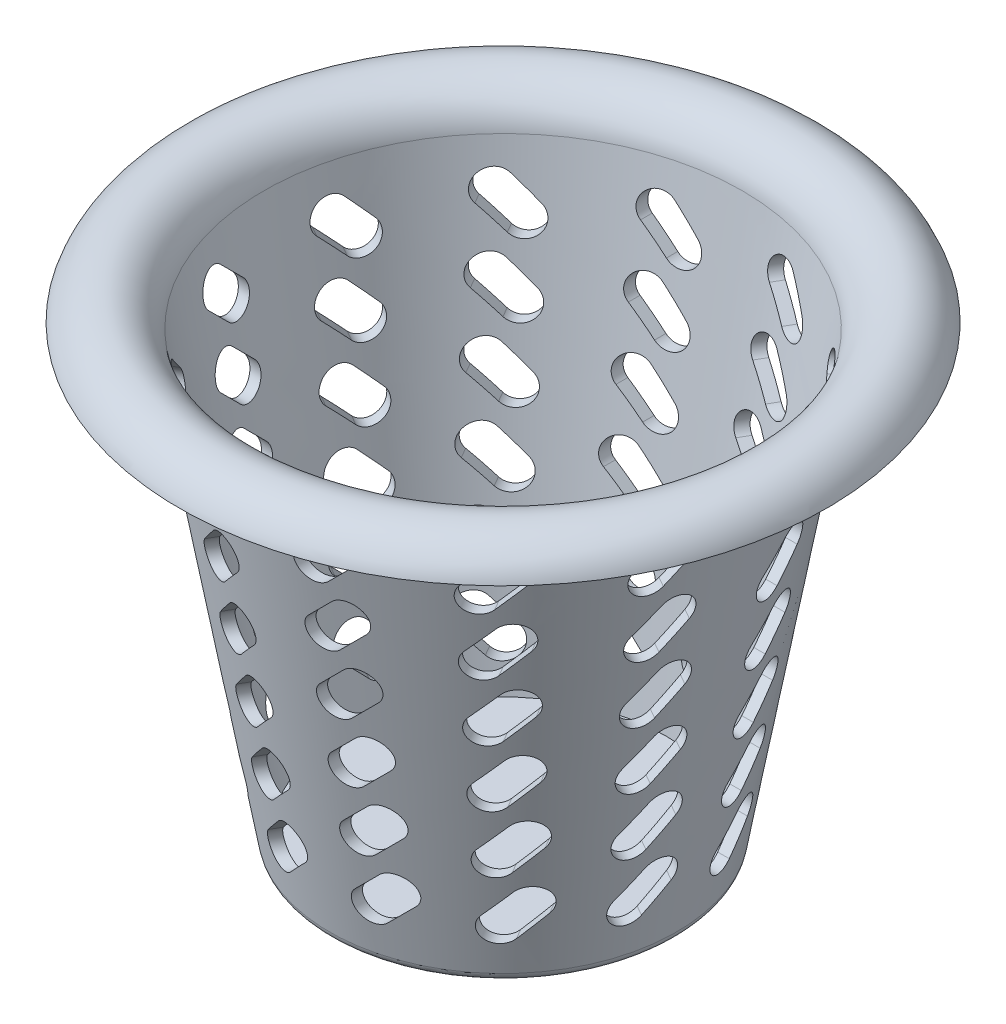
from build123d import *

# Parameters (mm, degrees)
FILLET1_R                 = 10
CUT_EXTRUDE1_DEPTH        = 605.228186298
LPATTERN1_COUNT           = 6
LPATTERN1_PITCH           = 60
CIRPATTERN1_COUNT         = 12
CIRPATTERN1_COPY_1_DEPTH  = 605.228186298
CIRPATTERN1_COPY_2_DEPTH  = 605.228186298
CIRPATTERN1_COPY_3_DEPTH  = 605.228186298
CIRPATTERN1_COPY_4_DEPTH  = 605.228186298
CIRPATTERN1_COPY_5_DEPTH  = 605.228186298
CIRPATTERN1_COPY_6_DEPTH  = 605.228186298
CIRPATTERN1_COPY_7_DEPTH  = 605.228186298
CIRPATTERN1_COPY_8_DEPTH  = 605.228186298
CIRPATTERN1_COPY_9_DEPTH  = 605.228186298
CIRPATTERN1_COPY_10_DEPTH = 605.228186298
CIRPATTERN1_COPY_11_DEPTH = 605.228186298
CIRPATTERN1_COPY_12_DEPTH = 605.228186298
CIRPATTERN1_COPY_13_DEPTH = 605.228186298
CIRPATTERN1_COPY_14_DEPTH = 605.228186298
CIRPATTERN1_COPY_15_DEPTH = 605.228186298
CIRPATTERN1_COPY_16_DEPTH = 605.228186298
CIRPATTERN1_COPY_17_DEPTH = 605.228186298
CIRPATTERN1_COPY_18_DEPTH = 605.228186298
CIRPATTERN1_COPY_19_DEPTH = 605.228186298
CIRPATTERN1_COPY_20_DEPTH = 605.228186298
CIRPATTERN1_COPY_21_DEPTH = 605.228186298
CIRPATTERN1_COPY_22_DEPTH = 605.228186298
CIRPATTERN1_COPY_23_DEPTH = 605.228186298
CIRPATTERN1_COPY_24_DEPTH = 605.228186298
CIRPATTERN1_COPY_25_DEPTH = 605.228186298
CIRPATTERN1_COPY_26_DEPTH = 605.228186298
CIRPATTERN1_COPY_27_DEPTH = 605.228186298
CIRPATTERN1_COPY_28_DEPTH = 605.228186298
CIRPATTERN1_COPY_29_DEPTH = 605.228186298
CIRPATTERN1_COPY_30_DEPTH = 605.228186298
CIRPATTERN1_COPY_31_DEPTH = 605.228186298
CIRPATTERN1_COPY_32_DEPTH = 605.228186298
CIRPATTERN1_COPY_33_DEPTH = 605.228186298
CIRPATTERN1_COPY_34_DEPTH = 605.228186298
CIRPATTERN1_COPY_35_DEPTH = 605.228186298
CIRPATTERN1_COPY_36_DEPTH = 605.228186298
CIRPATTERN1_COPY_37_DEPTH = 605.228186298
CIRPATTERN1_COPY_38_DEPTH = 605.228186298
CIRPATTERN1_COPY_39_DEPTH = 605.228186298
CIRPATTERN1_COPY_40_DEPTH = 605.228186298
CIRPATTERN1_COPY_41_DEPTH = 605.228186298
CIRPATTERN1_COPY_42_DEPTH = 605.228186298
CIRPATTERN1_COPY_43_DEPTH = 605.228186298
CIRPATTERN1_COPY_44_DEPTH = 605.228186298
CIRPATTERN1_COPY_45_DEPTH = 605.228186298
CIRPATTERN1_COPY_46_DEPTH = 605.228186298
CIRPATTERN1_COPY_47_DEPTH = 605.228186298
CIRPATTERN1_COPY_48_DEPTH = 605.228186298
CIRPATTERN1_COPY_49_DEPTH = 605.228186298
CIRPATTERN1_COPY_50_DEPTH = 605.228186298
CIRPATTERN1_COPY_51_DEPTH = 605.228186298
CIRPATTERN1_COPY_52_DEPTH = 605.228186298
CIRPATTERN1_COPY_53_DEPTH = 605.228186298
CIRPATTERN1_COPY_54_DEPTH = 605.228186298
CIRPATTERN1_COPY_55_DEPTH = 605.228186298


with BuildPart() as part:
    # Sketch1 → Revolve-Thin1 (revolve)
    with BuildSketch(Plane.XY, mode=Mode.PRIVATE) as revolve_thin1_sk:
        with BuildLine():
            Line((0, 0), (150, 0))
            Line((150, 0), (220.530792283, 400))
            ThreePointArc((220.530792283, 400), (257.118174154, 432.955606417), (297.956264392, 405.442720487))
            Line((297.956264392, 405.442720487), (288.447973895, 402.345558589))
            ThreePointArc((288.447973895, 402.345558589), (257.819406216, 422.980223036), (230.378869814, 398.263518223))
            Line((230.378869814, 398.263518223), (158.390996312, -10))
            Line((158.390996312, -10), (0, -10))
            Line((0, -10), (0, 0))
        make_face()
    revolve(revolve_thin1_sk.sketch.rotate(Axis((0, 0, 0), (0, 1, 0)), 90), axis=Axis((0, 0, 0), (0, 1, 0)))

    # Fillet1
    fillet1_edges = [part.edges().sort_by_distance(p)[0] for p in [
        (0, -10, 158.390996312),
    ]]
    fillet(fillet1_edges, radius=FILLET1_R)

    # Sketch2 → Cut-Extrude1 (cut, through all)
    with BuildSketch(Plane.XY):
        with BuildLine():
            Line((-51.213203436, 72.426406871), (-30, 51.213203436))
            ThreePointArc((-30, 51.213203436), (-30, 30), (-51.213203436, 30))
            Line((-51.213203436, 30), (-72.426406871, 51.213203436))
            ThreePointArc((-72.426406871, 51.213203436), (-72.426406871, 72.426406871), (-51.213203436, 72.426406871))
        make_face()
    cut_extrude1 = extrude(amount=-CUT_EXTRUDE1_DEPTH, mode=Mode.SUBTRACT)

    # LPattern1: Cut-Extrude1 ×6
    with Locations(*[(0, i * LPATTERN1_PITCH, 0) for i in range(1, LPATTERN1_COUNT)]):
        add(cut_extrude1, mode=Mode.SUBTRACT)

    # CirPattern1: Cut-Extrude1 ×12 about axis
    cirpattern1_axis = Axis((0, 0, 0), (0, 1, 0))
    for i in range(1, CIRPATTERN1_COUNT):
        add(cut_extrude1.rotate(cirpattern1_axis, i * 360 / CIRPATTERN1_COUNT), mode=Mode.SUBTRACT)

    # CirPattern1 copy 1 sketch → CirPattern1 copy 1 (cut, through all)
    with BuildSketch(Plane(origin=(0, 60, 0), x_dir=(0.8660254037844387, 0, -0.49999999999999994), z_dir=(0.49999999999999994, 0, 0.8660254037844387))):
        with BuildLine():
            Line((-51.213203436, 72.426406871), (-30, 51.213203436))
            ThreePointArc((-30, 51.213203436), (-30, 30), (-51.213203436, 30))
            Line((-51.213203436, 30), (-72.426406871, 51.213203436))
            ThreePointArc((-72.426406871, 51.213203436), (-72.426406871, 72.426406871), (-51.213203436, 72.426406871))
        make_face()
    extrude(amount=-CIRPATTERN1_COPY_1_DEPTH, mode=Mode.SUBTRACT)

    # CirPattern1 copy 2 sketch → CirPattern1 copy 2 (cut, through all)
    with BuildSketch(Plane(origin=(0, 60, 0), x_dir=(0.5000000000000001, 0, -0.8660254037844386), z_dir=(0.8660254037844386, 0, 0.5000000000000001))):
        with BuildLine():
            Line((-51.213203436, 72.426406871), (-30, 51.213203436))
            ThreePointArc((-30, 51.213203436), (-30, 30), (-51.213203436, 30))
            Line((-51.213203436, 30), (-72.426406871, 51.213203436))
            ThreePointArc((-72.426406871, 51.213203436), (-72.426406871, 72.426406871), (-51.213203436, 72.426406871))
        make_face()
    extrude(amount=-CIRPATTERN1_COPY_2_DEPTH, mode=Mode.SUBTRACT)

    # CirPattern1 copy 3 sketch → CirPattern1 copy 3 (cut, through all)
    with BuildSketch(Plane(origin=(0, 60, 0), x_dir=(0, 0, -1), z_dir=(1, 0, 0))):
        with BuildLine():
            Line((-51.213203436, 72.426406871), (-30, 51.213203436))
            ThreePointArc((-30, 51.213203436), (-30, 30), (-51.213203436, 30))
            Line((-51.213203436, 30), (-72.426406871, 51.213203436))
            ThreePointArc((-72.426406871, 51.213203436), (-72.426406871, 72.426406871), (-51.213203436, 72.426406871))
        make_face()
    extrude(amount=-CIRPATTERN1_COPY_3_DEPTH, mode=Mode.SUBTRACT)

    # CirPattern1 copy 4 sketch → CirPattern1 copy 4 (cut, through all)
    with BuildSketch(Plane(origin=(0, 60, 0), x_dir=(-0.4999999999999998, 0, -0.8660254037844387), z_dir=(0.8660254037844387, 0, -0.4999999999999998))):
        with BuildLine():
            Line((-51.213203436, 72.426406871), (-30, 51.213203436))
            ThreePointArc((-30, 51.213203436), (-30, 30), (-51.213203436, 30))
            Line((-51.213203436, 30), (-72.426406871, 51.213203436))
            ThreePointArc((-72.426406871, 51.213203436), (-72.426406871, 72.426406871), (-51.213203436, 72.426406871))
        make_face()
    extrude(amount=-CIRPATTERN1_COPY_4_DEPTH, mode=Mode.SUBTRACT)

    # CirPattern1 copy 5 sketch → CirPattern1 copy 5 (cut, through all)
    with BuildSketch(Plane(origin=(0, 60, 0), x_dir=(-0.8660254037844387, 0, -0.49999999999999994), z_dir=(0.49999999999999994, 0, -0.8660254037844387))):
        with BuildLine():
            Line((-51.213203436, 72.426406871), (-30, 51.213203436))
            ThreePointArc((-30, 51.213203436), (-30, 30), (-51.213203436, 30))
            Line((-51.213203436, 30), (-72.426406871, 51.213203436))
            ThreePointArc((-72.426406871, 51.213203436), (-72.426406871, 72.426406871), (-51.213203436, 72.426406871))
        make_face()
    extrude(amount=-CIRPATTERN1_COPY_5_DEPTH, mode=Mode.SUBTRACT)

    # CirPattern1 copy 6 sketch → CirPattern1 copy 6 (cut, through all)
    with BuildSketch(Plane(origin=(0, 60, 0), x_dir=(-1, 0, 0), z_dir=(0, 0, -1))):
        with BuildLine():
            Line((-51.213203436, 72.426406871), (-30, 51.213203436))
            ThreePointArc((-30, 51.213203436), (-30, 30), (-51.213203436, 30))
            Line((-51.213203436, 30), (-72.426406871, 51.213203436))
            ThreePointArc((-72.426406871, 51.213203436), (-72.426406871, 72.426406871), (-51.213203436, 72.426406871))
        make_face()
    extrude(amount=-CIRPATTERN1_COPY_6_DEPTH, mode=Mode.SUBTRACT)

    # CirPattern1 copy 7 sketch → CirPattern1 copy 7 (cut, through all)
    with BuildSketch(Plane(origin=(0, 60, 0), x_dir=(-0.8660254037844386, 0, 0.5000000000000001), z_dir=(-0.5000000000000001, 0, -0.8660254037844386))):
        with BuildLine():
            Line((-51.213203436, 72.426406871), (-30, 51.213203436))
            ThreePointArc((-30, 51.213203436), (-30, 30), (-51.213203436, 30))
            Line((-51.213203436, 30), (-72.426406871, 51.213203436))
            ThreePointArc((-72.426406871, 51.213203436), (-72.426406871, 72.426406871), (-51.213203436, 72.426406871))
        make_face()
    extrude(amount=-CIRPATTERN1_COPY_7_DEPTH, mode=Mode.SUBTRACT)

    # CirPattern1 copy 8 sketch → CirPattern1 copy 8 (cut, through all)
    with BuildSketch(Plane(origin=(0, 60, 0), x_dir=(-0.5000000000000004, 0, 0.8660254037844384), z_dir=(-0.8660254037844384, 0, -0.5000000000000004))):
        with BuildLine():
            Line((-51.213203436, 72.426406871), (-30, 51.213203436))
            ThreePointArc((-30, 51.213203436), (-30, 30), (-51.213203436, 30))
            Line((-51.213203436, 30), (-72.426406871, 51.213203436))
            ThreePointArc((-72.426406871, 51.213203436), (-72.426406871, 72.426406871), (-51.213203436, 72.426406871))
        make_face()
    extrude(amount=-CIRPATTERN1_COPY_8_DEPTH, mode=Mode.SUBTRACT)

    # CirPattern1 copy 9 sketch → CirPattern1 copy 9 (cut, through all)
    with BuildSketch(Plane(origin=(0, 60, 0), x_dir=(0, 0, 1), z_dir=(-1, 0, 0))):
        with BuildLine():
            Line((-51.213203436, 72.426406871), (-30, 51.213203436))
            ThreePointArc((-30, 51.213203436), (-30, 30), (-51.213203436, 30))
            Line((-51.213203436, 30), (-72.426406871, 51.213203436))
            ThreePointArc((-72.426406871, 51.213203436), (-72.426406871, 72.426406871), (-51.213203436, 72.426406871))
        make_face()
    extrude(amount=-CIRPATTERN1_COPY_9_DEPTH, mode=Mode.SUBTRACT)

    # CirPattern1 copy 10 sketch → CirPattern1 copy 10 (cut, through all)
    with BuildSketch(Plane(origin=(0, 60, 0), x_dir=(0.5000000000000001, 0, 0.8660254037844386), z_dir=(-0.8660254037844386, 0, 0.5000000000000001))):
        with BuildLine():
            Line((-51.213203436, 72.426406871), (-30, 51.213203436))
            ThreePointArc((-30, 51.213203436), (-30, 30), (-51.213203436, 30))
            Line((-51.213203436, 30), (-72.426406871, 51.213203436))
            ThreePointArc((-72.426406871, 51.213203436), (-72.426406871, 72.426406871), (-51.213203436, 72.426406871))
        make_face()
    extrude(amount=-CIRPATTERN1_COPY_10_DEPTH, mode=Mode.SUBTRACT)

    # CirPattern1 copy 11 sketch → CirPattern1 copy 11 (cut, through all)
    with BuildSketch(Plane(origin=(0, 60, 0), x_dir=(0.8660254037844384, 0, 0.5000000000000004), z_dir=(-0.5000000000000004, 0, 0.8660254037844384))):
        with BuildLine():
            Line((-51.213203436, 72.426406871), (-30, 51.213203436))
            ThreePointArc((-30, 51.213203436), (-30, 30), (-51.213203436, 30))
            Line((-51.213203436, 30), (-72.426406871, 51.213203436))
            ThreePointArc((-72.426406871, 51.213203436), (-72.426406871, 72.426406871), (-51.213203436, 72.426406871))
        make_face()
    extrude(amount=-CIRPATTERN1_COPY_11_DEPTH, mode=Mode.SUBTRACT)

    # CirPattern1 copy 12 sketch → CirPattern1 copy 12 (cut, through all)
    with BuildSketch(Plane(origin=(0, 120, 0), x_dir=(0.8660254037844387, 0, -0.49999999999999994), z_dir=(0.49999999999999994, 0, 0.8660254037844387))):
        with BuildLine():
            Line((-51.213203436, 72.426406871), (-30, 51.213203436))
            ThreePointArc((-30, 51.213203436), (-30, 30), (-51.213203436, 30))
            Line((-51.213203436, 30), (-72.426406871, 51.213203436))
            ThreePointArc((-72.426406871, 51.213203436), (-72.426406871, 72.426406871), (-51.213203436, 72.426406871))
        make_face()
    extrude(amount=-CIRPATTERN1_COPY_12_DEPTH, mode=Mode.SUBTRACT)

    # CirPattern1 copy 13 sketch → CirPattern1 copy 13 (cut, through all)
    with BuildSketch(Plane(origin=(0, 120, 0), x_dir=(0.5000000000000001, 0, -0.8660254037844386), z_dir=(0.8660254037844386, 0, 0.5000000000000001))):
        with BuildLine():
            Line((-51.213203436, 72.426406871), (-30, 51.213203436))
            ThreePointArc((-30, 51.213203436), (-30, 30), (-51.213203436, 30))
            Line((-51.213203436, 30), (-72.426406871, 51.213203436))
            ThreePointArc((-72.426406871, 51.213203436), (-72.426406871, 72.426406871), (-51.213203436, 72.426406871))
        make_face()
    extrude(amount=-CIRPATTERN1_COPY_13_DEPTH, mode=Mode.SUBTRACT)

    # CirPattern1 copy 14 sketch → CirPattern1 copy 14 (cut, through all)
    with BuildSketch(Plane(origin=(0, 120, 0), x_dir=(0, 0, -1), z_dir=(1, 0, 0))):
        with BuildLine():
            Line((-51.213203436, 72.426406871), (-30, 51.213203436))
            ThreePointArc((-30, 51.213203436), (-30, 30), (-51.213203436, 30))
            Line((-51.213203436, 30), (-72.426406871, 51.213203436))
            ThreePointArc((-72.426406871, 51.213203436), (-72.426406871, 72.426406871), (-51.213203436, 72.426406871))
        make_face()
    extrude(amount=-CIRPATTERN1_COPY_14_DEPTH, mode=Mode.SUBTRACT)

    # CirPattern1 copy 15 sketch → CirPattern1 copy 15 (cut, through all)
    with BuildSketch(Plane(origin=(0, 120, 0), x_dir=(-0.4999999999999998, 0, -0.8660254037844387), z_dir=(0.8660254037844387, 0, -0.4999999999999998))):
        with BuildLine():
            Line((-51.213203436, 72.426406871), (-30, 51.213203436))
            ThreePointArc((-30, 51.213203436), (-30, 30), (-51.213203436, 30))
            Line((-51.213203436, 30), (-72.426406871, 51.213203436))
            ThreePointArc((-72.426406871, 51.213203436), (-72.426406871, 72.426406871), (-51.213203436, 72.426406871))
        make_face()
    extrude(amount=-CIRPATTERN1_COPY_15_DEPTH, mode=Mode.SUBTRACT)

    # CirPattern1 copy 16 sketch → CirPattern1 copy 16 (cut, through all)
    with BuildSketch(Plane(origin=(0, 120, 0), x_dir=(-0.8660254037844387, 0, -0.49999999999999994), z_dir=(0.49999999999999994, 0, -0.8660254037844387))):
        with BuildLine():
            Line((-51.213203436, 72.426406871), (-30, 51.213203436))
            ThreePointArc((-30, 51.213203436), (-30, 30), (-51.213203436, 30))
            Line((-51.213203436, 30), (-72.426406871, 51.213203436))
            ThreePointArc((-72.426406871, 51.213203436), (-72.426406871, 72.426406871), (-51.213203436, 72.426406871))
        make_face()
    extrude(amount=-CIRPATTERN1_COPY_16_DEPTH, mode=Mode.SUBTRACT)

    # CirPattern1 copy 17 sketch → CirPattern1 copy 17 (cut, through all)
    with BuildSketch(Plane(origin=(0, 120, 0), x_dir=(-1, 0, 0), z_dir=(0, 0, -1))):
        with BuildLine():
            Line((-51.213203436, 72.426406871), (-30, 51.213203436))
            ThreePointArc((-30, 51.213203436), (-30, 30), (-51.213203436, 30))
            Line((-51.213203436, 30), (-72.426406871, 51.213203436))
            ThreePointArc((-72.426406871, 51.213203436), (-72.426406871, 72.426406871), (-51.213203436, 72.426406871))
        make_face()
    extrude(amount=-CIRPATTERN1_COPY_17_DEPTH, mode=Mode.SUBTRACT)

    # CirPattern1 copy 18 sketch → CirPattern1 copy 18 (cut, through all)
    with BuildSketch(Plane(origin=(0, 120, 0), x_dir=(-0.8660254037844386, 0, 0.5000000000000001), z_dir=(-0.5000000000000001, 0, -0.8660254037844386))):
        with BuildLine():
            Line((-51.213203436, 72.426406871), (-30, 51.213203436))
            ThreePointArc((-30, 51.213203436), (-30, 30), (-51.213203436, 30))
            Line((-51.213203436, 30), (-72.426406871, 51.213203436))
            ThreePointArc((-72.426406871, 51.213203436), (-72.426406871, 72.426406871), (-51.213203436, 72.426406871))
        make_face()
    extrude(amount=-CIRPATTERN1_COPY_18_DEPTH, mode=Mode.SUBTRACT)

    # CirPattern1 copy 19 sketch → CirPattern1 copy 19 (cut, through all)
    with BuildSketch(Plane(origin=(0, 120, 0), x_dir=(-0.5000000000000004, 0, 0.8660254037844384), z_dir=(-0.8660254037844384, 0, -0.5000000000000004))):
        with BuildLine():
            Line((-51.213203436, 72.426406871), (-30, 51.213203436))
            ThreePointArc((-30, 51.213203436), (-30, 30), (-51.213203436, 30))
            Line((-51.213203436, 30), (-72.426406871, 51.213203436))
            ThreePointArc((-72.426406871, 51.213203436), (-72.426406871, 72.426406871), (-51.213203436, 72.426406871))
        make_face()
    extrude(amount=-CIRPATTERN1_COPY_19_DEPTH, mode=Mode.SUBTRACT)

    # CirPattern1 copy 20 sketch → CirPattern1 copy 20 (cut, through all)
    with BuildSketch(Plane(origin=(0, 120, 0), x_dir=(0, 0, 1), z_dir=(-1, 0, 0))):
        with BuildLine():
            Line((-51.213203436, 72.426406871), (-30, 51.213203436))
            ThreePointArc((-30, 51.213203436), (-30, 30), (-51.213203436, 30))
            Line((-51.213203436, 30), (-72.426406871, 51.213203436))
            ThreePointArc((-72.426406871, 51.213203436), (-72.426406871, 72.426406871), (-51.213203436, 72.426406871))
        make_face()
    extrude(amount=-CIRPATTERN1_COPY_20_DEPTH, mode=Mode.SUBTRACT)

    # CirPattern1 copy 21 sketch → CirPattern1 copy 21 (cut, through all)
    with BuildSketch(Plane(origin=(0, 120, 0), x_dir=(0.5000000000000001, 0, 0.8660254037844386), z_dir=(-0.8660254037844386, 0, 0.5000000000000001))):
        with BuildLine():
            Line((-51.213203436, 72.426406871), (-30, 51.213203436))
            ThreePointArc((-30, 51.213203436), (-30, 30), (-51.213203436, 30))
            Line((-51.213203436, 30), (-72.426406871, 51.213203436))
            ThreePointArc((-72.426406871, 51.213203436), (-72.426406871, 72.426406871), (-51.213203436, 72.426406871))
        make_face()
    extrude(amount=-CIRPATTERN1_COPY_21_DEPTH, mode=Mode.SUBTRACT)

    # CirPattern1 copy 22 sketch → CirPattern1 copy 22 (cut, through all)
    with BuildSketch(Plane(origin=(0, 120, 0), x_dir=(0.8660254037844384, 0, 0.5000000000000004), z_dir=(-0.5000000000000004, 0, 0.8660254037844384))):
        with BuildLine():
            Line((-51.213203436, 72.426406871), (-30, 51.213203436))
            ThreePointArc((-30, 51.213203436), (-30, 30), (-51.213203436, 30))
            Line((-51.213203436, 30), (-72.426406871, 51.213203436))
            ThreePointArc((-72.426406871, 51.213203436), (-72.426406871, 72.426406871), (-51.213203436, 72.426406871))
        make_face()
    extrude(amount=-CIRPATTERN1_COPY_22_DEPTH, mode=Mode.SUBTRACT)

    # CirPattern1 copy 23 sketch → CirPattern1 copy 23 (cut, through all)
    with BuildSketch(Plane(origin=(0, 180, 0), x_dir=(0.8660254037844387, 0, -0.49999999999999994), z_dir=(0.49999999999999994, 0, 0.8660254037844387))):
        with BuildLine():
            Line((-51.213203436, 72.426406871), (-30, 51.213203436))
            ThreePointArc((-30, 51.213203436), (-30, 30), (-51.213203436, 30))
            Line((-51.213203436, 30), (-72.426406871, 51.213203436))
            ThreePointArc((-72.426406871, 51.213203436), (-72.426406871, 72.426406871), (-51.213203436, 72.426406871))
        make_face()
    extrude(amount=-CIRPATTERN1_COPY_23_DEPTH, mode=Mode.SUBTRACT)

    # CirPattern1 copy 24 sketch → CirPattern1 copy 24 (cut, through all)
    with BuildSketch(Plane(origin=(0, 180, 0), x_dir=(0.5000000000000001, 0, -0.8660254037844386), z_dir=(0.8660254037844386, 0, 0.5000000000000001))):
        with BuildLine():
            Line((-51.213203436, 72.426406871), (-30, 51.213203436))
            ThreePointArc((-30, 51.213203436), (-30, 30), (-51.213203436, 30))
            Line((-51.213203436, 30), (-72.426406871, 51.213203436))
            ThreePointArc((-72.426406871, 51.213203436), (-72.426406871, 72.426406871), (-51.213203436, 72.426406871))
        make_face()
    extrude(amount=-CIRPATTERN1_COPY_24_DEPTH, mode=Mode.SUBTRACT)

    # CirPattern1 copy 25 sketch → CirPattern1 copy 25 (cut, through all)
    with BuildSketch(Plane(origin=(0, 180, 0), x_dir=(0, 0, -1), z_dir=(1, 0, 0))):
        with BuildLine():
            Line((-51.213203436, 72.426406871), (-30, 51.213203436))
            ThreePointArc((-30, 51.213203436), (-30, 30), (-51.213203436, 30))
            Line((-51.213203436, 30), (-72.426406871, 51.213203436))
            ThreePointArc((-72.426406871, 51.213203436), (-72.426406871, 72.426406871), (-51.213203436, 72.426406871))
        make_face()
    extrude(amount=-CIRPATTERN1_COPY_25_DEPTH, mode=Mode.SUBTRACT)

    # CirPattern1 copy 26 sketch → CirPattern1 copy 26 (cut, through all)
    with BuildSketch(Plane(origin=(0, 180, 0), x_dir=(-0.4999999999999998, 0, -0.8660254037844387), z_dir=(0.8660254037844387, 0, -0.4999999999999998))):
        with BuildLine():
            Line((-51.213203436, 72.426406871), (-30, 51.213203436))
            ThreePointArc((-30, 51.213203436), (-30, 30), (-51.213203436, 30))
            Line((-51.213203436, 30), (-72.426406871, 51.213203436))
            ThreePointArc((-72.426406871, 51.213203436), (-72.426406871, 72.426406871), (-51.213203436, 72.426406871))
        make_face()
    extrude(amount=-CIRPATTERN1_COPY_26_DEPTH, mode=Mode.SUBTRACT)

    # CirPattern1 copy 27 sketch → CirPattern1 copy 27 (cut, through all)
    with BuildSketch(Plane(origin=(0, 180, 0), x_dir=(-0.8660254037844387, 0, -0.49999999999999994), z_dir=(0.49999999999999994, 0, -0.8660254037844387))):
        with BuildLine():
            Line((-51.213203436, 72.426406871), (-30, 51.213203436))
            ThreePointArc((-30, 51.213203436), (-30, 30), (-51.213203436, 30))
            Line((-51.213203436, 30), (-72.426406871, 51.213203436))
            ThreePointArc((-72.426406871, 51.213203436), (-72.426406871, 72.426406871), (-51.213203436, 72.426406871))
        make_face()
    extrude(amount=-CIRPATTERN1_COPY_27_DEPTH, mode=Mode.SUBTRACT)

    # CirPattern1 copy 28 sketch → CirPattern1 copy 28 (cut, through all)
    with BuildSketch(Plane(origin=(0, 180, 0), x_dir=(-1, 0, 0), z_dir=(0, 0, -1))):
        with BuildLine():
            Line((-51.213203436, 72.426406871), (-30, 51.213203436))
            ThreePointArc((-30, 51.213203436), (-30, 30), (-51.213203436, 30))
            Line((-51.213203436, 30), (-72.426406871, 51.213203436))
            ThreePointArc((-72.426406871, 51.213203436), (-72.426406871, 72.426406871), (-51.213203436, 72.426406871))
        make_face()
    extrude(amount=-CIRPATTERN1_COPY_28_DEPTH, mode=Mode.SUBTRACT)

    # CirPattern1 copy 29 sketch → CirPattern1 copy 29 (cut, through all)
    with BuildSketch(Plane(origin=(0, 180, 0), x_dir=(-0.8660254037844386, 0, 0.5000000000000001), z_dir=(-0.5000000000000001, 0, -0.8660254037844386))):
        with BuildLine():
            Line((-51.213203436, 72.426406871), (-30, 51.213203436))
            ThreePointArc((-30, 51.213203436), (-30, 30), (-51.213203436, 30))
            Line((-51.213203436, 30), (-72.426406871, 51.213203436))
            ThreePointArc((-72.426406871, 51.213203436), (-72.426406871, 72.426406871), (-51.213203436, 72.426406871))
        make_face()
    extrude(amount=-CIRPATTERN1_COPY_29_DEPTH, mode=Mode.SUBTRACT)

    # CirPattern1 copy 30 sketch → CirPattern1 copy 30 (cut, through all)
    with BuildSketch(Plane(origin=(0, 180, 0), x_dir=(-0.5000000000000004, 0, 0.8660254037844384), z_dir=(-0.8660254037844384, 0, -0.5000000000000004))):
        with BuildLine():
            Line((-51.213203436, 72.426406871), (-30, 51.213203436))
            ThreePointArc((-30, 51.213203436), (-30, 30), (-51.213203436, 30))
            Line((-51.213203436, 30), (-72.426406871, 51.213203436))
            ThreePointArc((-72.426406871, 51.213203436), (-72.426406871, 72.426406871), (-51.213203436, 72.426406871))
        make_face()
    extrude(amount=-CIRPATTERN1_COPY_30_DEPTH, mode=Mode.SUBTRACT)

    # CirPattern1 copy 31 sketch → CirPattern1 copy 31 (cut, through all)
    with BuildSketch(Plane(origin=(0, 180, 0), x_dir=(0, 0, 1), z_dir=(-1, 0, 0))):
        with BuildLine():
            Line((-51.213203436, 72.426406871), (-30, 51.213203436))
            ThreePointArc((-30, 51.213203436), (-30, 30), (-51.213203436, 30))
            Line((-51.213203436, 30), (-72.426406871, 51.213203436))
            ThreePointArc((-72.426406871, 51.213203436), (-72.426406871, 72.426406871), (-51.213203436, 72.426406871))
        make_face()
    extrude(amount=-CIRPATTERN1_COPY_31_DEPTH, mode=Mode.SUBTRACT)

    # CirPattern1 copy 32 sketch → CirPattern1 copy 32 (cut, through all)
    with BuildSketch(Plane(origin=(0, 180, 0), x_dir=(0.5000000000000001, 0, 0.8660254037844386), z_dir=(-0.8660254037844386, 0, 0.5000000000000001))):
        with BuildLine():
            Line((-51.213203436, 72.426406871), (-30, 51.213203436))
            ThreePointArc((-30, 51.213203436), (-30, 30), (-51.213203436, 30))
            Line((-51.213203436, 30), (-72.426406871, 51.213203436))
            ThreePointArc((-72.426406871, 51.213203436), (-72.426406871, 72.426406871), (-51.213203436, 72.426406871))
        make_face()
    extrude(amount=-CIRPATTERN1_COPY_32_DEPTH, mode=Mode.SUBTRACT)

    # CirPattern1 copy 33 sketch → CirPattern1 copy 33 (cut, through all)
    with BuildSketch(Plane(origin=(0, 180, 0), x_dir=(0.8660254037844384, 0, 0.5000000000000004), z_dir=(-0.5000000000000004, 0, 0.8660254037844384))):
        with BuildLine():
            Line((-51.213203436, 72.426406871), (-30, 51.213203436))
            ThreePointArc((-30, 51.213203436), (-30, 30), (-51.213203436, 30))
            Line((-51.213203436, 30), (-72.426406871, 51.213203436))
            ThreePointArc((-72.426406871, 51.213203436), (-72.426406871, 72.426406871), (-51.213203436, 72.426406871))
        make_face()
    extrude(amount=-CIRPATTERN1_COPY_33_DEPTH, mode=Mode.SUBTRACT)

    # CirPattern1 copy 34 sketch → CirPattern1 copy 34 (cut, through all)
    with BuildSketch(Plane(origin=(0, 240, 0), x_dir=(0.8660254037844387, 0, -0.49999999999999994), z_dir=(0.49999999999999994, 0, 0.8660254037844387))):
        with BuildLine():
            Line((-51.213203436, 72.426406871), (-30, 51.213203436))
            ThreePointArc((-30, 51.213203436), (-30, 30), (-51.213203436, 30))
            Line((-51.213203436, 30), (-72.426406871, 51.213203436))
            ThreePointArc((-72.426406871, 51.213203436), (-72.426406871, 72.426406871), (-51.213203436, 72.426406871))
        make_face()
    extrude(amount=-CIRPATTERN1_COPY_34_DEPTH, mode=Mode.SUBTRACT)

    # CirPattern1 copy 35 sketch → CirPattern1 copy 35 (cut, through all)
    with BuildSketch(Plane(origin=(0, 240, 0), x_dir=(0.5000000000000001, 0, -0.8660254037844386), z_dir=(0.8660254037844386, 0, 0.5000000000000001))):
        with BuildLine():
            Line((-51.213203436, 72.426406871), (-30, 51.213203436))
            ThreePointArc((-30, 51.213203436), (-30, 30), (-51.213203436, 30))
            Line((-51.213203436, 30), (-72.426406871, 51.213203436))
            ThreePointArc((-72.426406871, 51.213203436), (-72.426406871, 72.426406871), (-51.213203436, 72.426406871))
        make_face()
    extrude(amount=-CIRPATTERN1_COPY_35_DEPTH, mode=Mode.SUBTRACT)

    # CirPattern1 copy 36 sketch → CirPattern1 copy 36 (cut, through all)
    with BuildSketch(Plane(origin=(0, 240, 0), x_dir=(0, 0, -1), z_dir=(1, 0, 0))):
        with BuildLine():
            Line((-51.213203436, 72.426406871), (-30, 51.213203436))
            ThreePointArc((-30, 51.213203436), (-30, 30), (-51.213203436, 30))
            Line((-51.213203436, 30), (-72.426406871, 51.213203436))
            ThreePointArc((-72.426406871, 51.213203436), (-72.426406871, 72.426406871), (-51.213203436, 72.426406871))
        make_face()
    extrude(amount=-CIRPATTERN1_COPY_36_DEPTH, mode=Mode.SUBTRACT)

    # CirPattern1 copy 37 sketch → CirPattern1 copy 37 (cut, through all)
    with BuildSketch(Plane(origin=(0, 240, 0), x_dir=(-0.4999999999999998, 0, -0.8660254037844387), z_dir=(0.8660254037844387, 0, -0.4999999999999998))):
        with BuildLine():
            Line((-51.213203436, 72.426406871), (-30, 51.213203436))
            ThreePointArc((-30, 51.213203436), (-30, 30), (-51.213203436, 30))
            Line((-51.213203436, 30), (-72.426406871, 51.213203436))
            ThreePointArc((-72.426406871, 51.213203436), (-72.426406871, 72.426406871), (-51.213203436, 72.426406871))
        make_face()
    extrude(amount=-CIRPATTERN1_COPY_37_DEPTH, mode=Mode.SUBTRACT)

    # CirPattern1 copy 38 sketch → CirPattern1 copy 38 (cut, through all)
    with BuildSketch(Plane(origin=(0, 240, 0), x_dir=(-0.8660254037844387, 0, -0.49999999999999994), z_dir=(0.49999999999999994, 0, -0.8660254037844387))):
        with BuildLine():
            Line((-51.213203436, 72.426406871), (-30, 51.213203436))
            ThreePointArc((-30, 51.213203436), (-30, 30), (-51.213203436, 30))
            Line((-51.213203436, 30), (-72.426406871, 51.213203436))
            ThreePointArc((-72.426406871, 51.213203436), (-72.426406871, 72.426406871), (-51.213203436, 72.426406871))
        make_face()
    extrude(amount=-CIRPATTERN1_COPY_38_DEPTH, mode=Mode.SUBTRACT)

    # CirPattern1 copy 39 sketch → CirPattern1 copy 39 (cut, through all)
    with BuildSketch(Plane(origin=(0, 240, 0), x_dir=(-1, 0, 0), z_dir=(0, 0, -1))):
        with BuildLine():
            Line((-51.213203436, 72.426406871), (-30, 51.213203436))
            ThreePointArc((-30, 51.213203436), (-30, 30), (-51.213203436, 30))
            Line((-51.213203436, 30), (-72.426406871, 51.213203436))
            ThreePointArc((-72.426406871, 51.213203436), (-72.426406871, 72.426406871), (-51.213203436, 72.426406871))
        make_face()
    extrude(amount=-CIRPATTERN1_COPY_39_DEPTH, mode=Mode.SUBTRACT)

    # CirPattern1 copy 40 sketch → CirPattern1 copy 40 (cut, through all)
    with BuildSketch(Plane(origin=(0, 240, 0), x_dir=(-0.8660254037844386, 0, 0.5000000000000001), z_dir=(-0.5000000000000001, 0, -0.8660254037844386))):
        with BuildLine():
            Line((-51.213203436, 72.426406871), (-30, 51.213203436))
            ThreePointArc((-30, 51.213203436), (-30, 30), (-51.213203436, 30))
            Line((-51.213203436, 30), (-72.426406871, 51.213203436))
            ThreePointArc((-72.426406871, 51.213203436), (-72.426406871, 72.426406871), (-51.213203436, 72.426406871))
        make_face()
    extrude(amount=-CIRPATTERN1_COPY_40_DEPTH, mode=Mode.SUBTRACT)

    # CirPattern1 copy 41 sketch → CirPattern1 copy 41 (cut, through all)
    with BuildSketch(Plane(origin=(0, 240, 0), x_dir=(-0.5000000000000004, 0, 0.8660254037844384), z_dir=(-0.8660254037844384, 0, -0.5000000000000004))):
        with BuildLine():
            Line((-51.213203436, 72.426406871), (-30, 51.213203436))
            ThreePointArc((-30, 51.213203436), (-30, 30), (-51.213203436, 30))
            Line((-51.213203436, 30), (-72.426406871, 51.213203436))
            ThreePointArc((-72.426406871, 51.213203436), (-72.426406871, 72.426406871), (-51.213203436, 72.426406871))
        make_face()
    extrude(amount=-CIRPATTERN1_COPY_41_DEPTH, mode=Mode.SUBTRACT)

    # CirPattern1 copy 42 sketch → CirPattern1 copy 42 (cut, through all)
    with BuildSketch(Plane(origin=(0, 240, 0), x_dir=(0, 0, 1), z_dir=(-1, 0, 0))):
        with BuildLine():
            Line((-51.213203436, 72.426406871), (-30, 51.213203436))
            ThreePointArc((-30, 51.213203436), (-30, 30), (-51.213203436, 30))
            Line((-51.213203436, 30), (-72.426406871, 51.213203436))
            ThreePointArc((-72.426406871, 51.213203436), (-72.426406871, 72.426406871), (-51.213203436, 72.426406871))
        make_face()
    extrude(amount=-CIRPATTERN1_COPY_42_DEPTH, mode=Mode.SUBTRACT)

    # CirPattern1 copy 43 sketch → CirPattern1 copy 43 (cut, through all)
    with BuildSketch(Plane(origin=(0, 240, 0), x_dir=(0.5000000000000001, 0, 0.8660254037844386), z_dir=(-0.8660254037844386, 0, 0.5000000000000001))):
        with BuildLine():
            Line((-51.213203436, 72.426406871), (-30, 51.213203436))
            ThreePointArc((-30, 51.213203436), (-30, 30), (-51.213203436, 30))
            Line((-51.213203436, 30), (-72.426406871, 51.213203436))
            ThreePointArc((-72.426406871, 51.213203436), (-72.426406871, 72.426406871), (-51.213203436, 72.426406871))
        make_face()
    extrude(amount=-CIRPATTERN1_COPY_43_DEPTH, mode=Mode.SUBTRACT)

    # CirPattern1 copy 44 sketch → CirPattern1 copy 44 (cut, through all)
    with BuildSketch(Plane(origin=(0, 240, 0), x_dir=(0.8660254037844384, 0, 0.5000000000000004), z_dir=(-0.5000000000000004, 0, 0.8660254037844384))):
        with BuildLine():
            Line((-51.213203436, 72.426406871), (-30, 51.213203436))
            ThreePointArc((-30, 51.213203436), (-30, 30), (-51.213203436, 30))
            Line((-51.213203436, 30), (-72.426406871, 51.213203436))
            ThreePointArc((-72.426406871, 51.213203436), (-72.426406871, 72.426406871), (-51.213203436, 72.426406871))
        make_face()
    extrude(amount=-CIRPATTERN1_COPY_44_DEPTH, mode=Mode.SUBTRACT)

    # CirPattern1 copy 45 sketch → CirPattern1 copy 45 (cut, through all)
    with BuildSketch(Plane(origin=(0, 300, 0), x_dir=(0.8660254037844387, 0, -0.49999999999999994), z_dir=(0.49999999999999994, 0, 0.8660254037844387))):
        with BuildLine():
            Line((-51.213203436, 72.426406871), (-30, 51.213203436))
            ThreePointArc((-30, 51.213203436), (-30, 30), (-51.213203436, 30))
            Line((-51.213203436, 30), (-72.426406871, 51.213203436))
            ThreePointArc((-72.426406871, 51.213203436), (-72.426406871, 72.426406871), (-51.213203436, 72.426406871))
        make_face()
    extrude(amount=-CIRPATTERN1_COPY_45_DEPTH, mode=Mode.SUBTRACT)

    # CirPattern1 copy 46 sketch → CirPattern1 copy 46 (cut, through all)
    with BuildSketch(Plane(origin=(0, 300, 0), x_dir=(0.5000000000000001, 0, -0.8660254037844386), z_dir=(0.8660254037844386, 0, 0.5000000000000001))):
        with BuildLine():
            Line((-51.213203436, 72.426406871), (-30, 51.213203436))
            ThreePointArc((-30, 51.213203436), (-30, 30), (-51.213203436, 30))
            Line((-51.213203436, 30), (-72.426406871, 51.213203436))
            ThreePointArc((-72.426406871, 51.213203436), (-72.426406871, 72.426406871), (-51.213203436, 72.426406871))
        make_face()
    extrude(amount=-CIRPATTERN1_COPY_46_DEPTH, mode=Mode.SUBTRACT)

    # CirPattern1 copy 47 sketch → CirPattern1 copy 47 (cut, through all)
    with BuildSketch(Plane(origin=(0, 300, 0), x_dir=(0, 0, -1), z_dir=(1, 0, 0))):
        with BuildLine():
            Line((-51.213203436, 72.426406871), (-30, 51.213203436))
            ThreePointArc((-30, 51.213203436), (-30, 30), (-51.213203436, 30))
            Line((-51.213203436, 30), (-72.426406871, 51.213203436))
            ThreePointArc((-72.426406871, 51.213203436), (-72.426406871, 72.426406871), (-51.213203436, 72.426406871))
        make_face()
    extrude(amount=-CIRPATTERN1_COPY_47_DEPTH, mode=Mode.SUBTRACT)

    # CirPattern1 copy 48 sketch → CirPattern1 copy 48 (cut, through all)
    with BuildSketch(Plane(origin=(0, 300, 0), x_dir=(-0.4999999999999998, 0, -0.8660254037844387), z_dir=(0.8660254037844387, 0, -0.4999999999999998))):
        with BuildLine():
            Line((-51.213203436, 72.426406871), (-30, 51.213203436))
            ThreePointArc((-30, 51.213203436), (-30, 30), (-51.213203436, 30))
            Line((-51.213203436, 30), (-72.426406871, 51.213203436))
            ThreePointArc((-72.426406871, 51.213203436), (-72.426406871, 72.426406871), (-51.213203436, 72.426406871))
        make_face()
    extrude(amount=-CIRPATTERN1_COPY_48_DEPTH, mode=Mode.SUBTRACT)

    # CirPattern1 copy 49 sketch → CirPattern1 copy 49 (cut, through all)
    with BuildSketch(Plane(origin=(0, 300, 0), x_dir=(-0.8660254037844387, 0, -0.49999999999999994), z_dir=(0.49999999999999994, 0, -0.8660254037844387))):
        with BuildLine():
            Line((-51.213203436, 72.426406871), (-30, 51.213203436))
            ThreePointArc((-30, 51.213203436), (-30, 30), (-51.213203436, 30))
            Line((-51.213203436, 30), (-72.426406871, 51.213203436))
            ThreePointArc((-72.426406871, 51.213203436), (-72.426406871, 72.426406871), (-51.213203436, 72.426406871))
        make_face()
    extrude(amount=-CIRPATTERN1_COPY_49_DEPTH, mode=Mode.SUBTRACT)

    # CirPattern1 copy 50 sketch → CirPattern1 copy 50 (cut, through all)
    with BuildSketch(Plane(origin=(0, 300, 0), x_dir=(-1, 0, 0), z_dir=(0, 0, -1))):
        with BuildLine():
            Line((-51.213203436, 72.426406871), (-30, 51.213203436))
            ThreePointArc((-30, 51.213203436), (-30, 30), (-51.213203436, 30))
            Line((-51.213203436, 30), (-72.426406871, 51.213203436))
            ThreePointArc((-72.426406871, 51.213203436), (-72.426406871, 72.426406871), (-51.213203436, 72.426406871))
        make_face()
    extrude(amount=-CIRPATTERN1_COPY_50_DEPTH, mode=Mode.SUBTRACT)

    # CirPattern1 copy 51 sketch → CirPattern1 copy 51 (cut, through all)
    with BuildSketch(Plane(origin=(0, 300, 0), x_dir=(-0.8660254037844386, 0, 0.5000000000000001), z_dir=(-0.5000000000000001, 0, -0.8660254037844386))):
        with BuildLine():
            Line((-51.213203436, 72.426406871), (-30, 51.213203436))
            ThreePointArc((-30, 51.213203436), (-30, 30), (-51.213203436, 30))
            Line((-51.213203436, 30), (-72.426406871, 51.213203436))
            ThreePointArc((-72.426406871, 51.213203436), (-72.426406871, 72.426406871), (-51.213203436, 72.426406871))
        make_face()
    extrude(amount=-CIRPATTERN1_COPY_51_DEPTH, mode=Mode.SUBTRACT)

    # CirPattern1 copy 52 sketch → CirPattern1 copy 52 (cut, through all)
    with BuildSketch(Plane(origin=(0, 300, 0), x_dir=(-0.5000000000000004, 0, 0.8660254037844384), z_dir=(-0.8660254037844384, 0, -0.5000000000000004))):
        with BuildLine():
            Line((-51.213203436, 72.426406871), (-30, 51.213203436))
            ThreePointArc((-30, 51.213203436), (-30, 30), (-51.213203436, 30))
            Line((-51.213203436, 30), (-72.426406871, 51.213203436))
            ThreePointArc((-72.426406871, 51.213203436), (-72.426406871, 72.426406871), (-51.213203436, 72.426406871))
        make_face()
    extrude(amount=-CIRPATTERN1_COPY_52_DEPTH, mode=Mode.SUBTRACT)

    # CirPattern1 copy 53 sketch → CirPattern1 copy 53 (cut, through all)
    with BuildSketch(Plane(origin=(0, 300, 0), x_dir=(0, 0, 1), z_dir=(-1, 0, 0))):
        with BuildLine():
            Line((-51.213203436, 72.426406871), (-30, 51.213203436))
            ThreePointArc((-30, 51.213203436), (-30, 30), (-51.213203436, 30))
            Line((-51.213203436, 30), (-72.426406871, 51.213203436))
            ThreePointArc((-72.426406871, 51.213203436), (-72.426406871, 72.426406871), (-51.213203436, 72.426406871))
        make_face()
    extrude(amount=-CIRPATTERN1_COPY_53_DEPTH, mode=Mode.SUBTRACT)

    # CirPattern1 copy 54 sketch → CirPattern1 copy 54 (cut, through all)
    with BuildSketch(Plane(origin=(0, 300, 0), x_dir=(0.5000000000000001, 0, 0.8660254037844386), z_dir=(-0.8660254037844386, 0, 0.5000000000000001))):
        with BuildLine():
            Line((-51.213203436, 72.426406871), (-30, 51.213203436))
            ThreePointArc((-30, 51.213203436), (-30, 30), (-51.213203436, 30))
            Line((-51.213203436, 30), (-72.426406871, 51.213203436))
            ThreePointArc((-72.426406871, 51.213203436), (-72.426406871, 72.426406871), (-51.213203436, 72.426406871))
        make_face()
    extrude(amount=-CIRPATTERN1_COPY_54_DEPTH, mode=Mode.SUBTRACT)

    # CirPattern1 copy 55 sketch → CirPattern1 copy 55 (cut, through all)
    with BuildSketch(Plane(origin=(0, 300, 0), x_dir=(0.8660254037844384, 0, 0.5000000000000004), z_dir=(-0.5000000000000004, 0, 0.8660254037844384))):
        with BuildLine():
            Line((-51.213203436, 72.426406871), (-30, 51.213203436))
            ThreePointArc((-30, 51.213203436), (-30, 30), (-51.213203436, 30))
            Line((-51.213203436, 30), (-72.426406871, 51.213203436))
            ThreePointArc((-72.426406871, 51.213203436), (-72.426406871, 72.426406871), (-51.213203436, 72.426406871))
        make_face()
    extrude(amount=-CIRPATTERN1_COPY_55_DEPTH, mode=Mode.SUBTRACT)


solid = part.part
